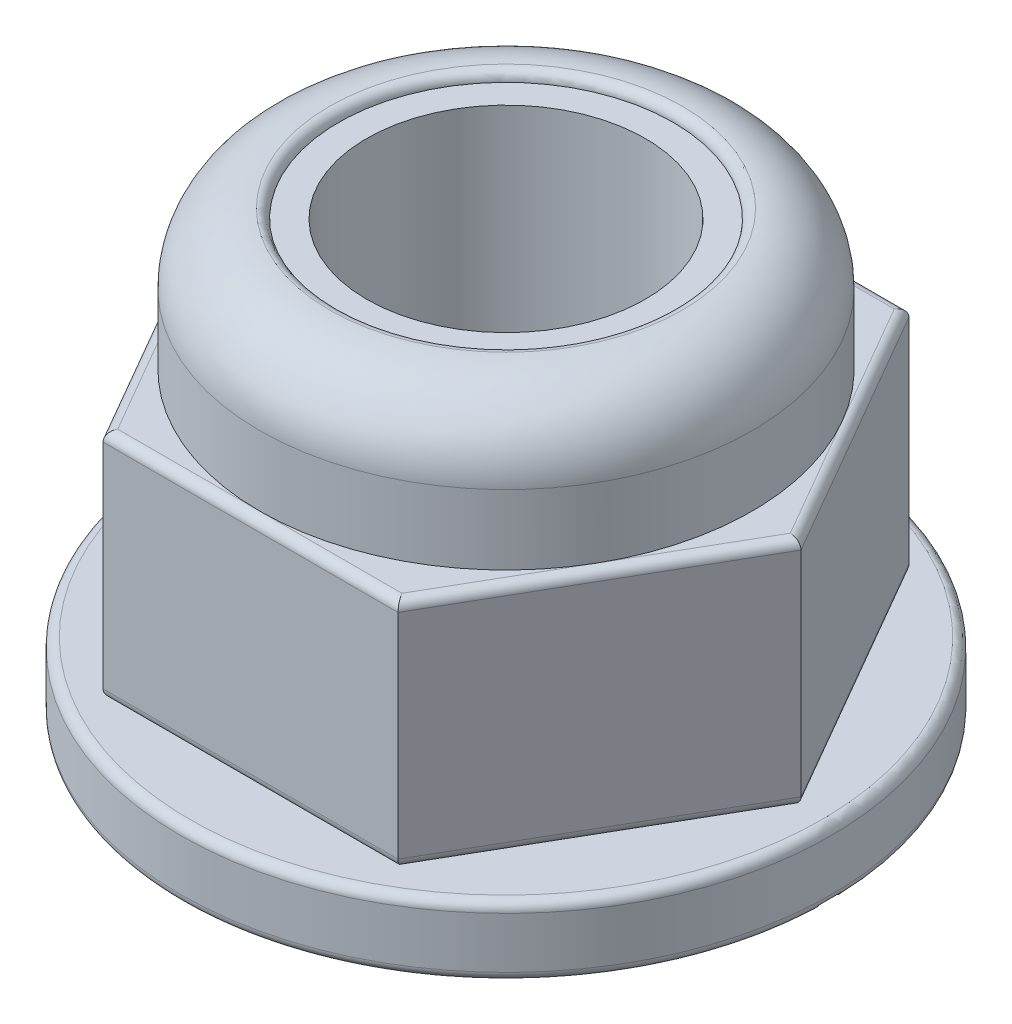
from build123d import *

# Parameters (mm, degrees)
SKETCH1_R           = 1.5
BOSS_EXTRUDE1_DEPTH = 4
FILLET1_R           = 0.1
CUT_EXTRUDE1_START  = -0.1
SKETCH3_R           = 1.8
SKETCH3_R_2         = 1.5
CUT_EXTRUDE1_DEPTH  = 0.1
FILLET2_R           = 0.1
BOSS_EXTRUDE2_START = 0.75
SKETCH4_R           = 3.5
SKETCH4_R_2         = 1.5
BOSS_EXTRUDE2_DEPTH = 0.75
FILLET3_R           = 0.1


# Some blends are built 0.0001 mm under size
with BuildPart() as part:
    # Sketch1 → Boss-Extrude1 (new body)
    with BuildSketch(Plane(origin=(0, 0, 0), x_dir=(1, 0, 0), z_dir=(0, 1, 0))):
        Polygon((1.58771324, -2.75), (3.175426481, 0), (1.58771324, 2.75), (-1.58771324, 2.75), (-3.175426481, 0), (-1.58771324, -2.75), align=None)
        with Locations(Location((0, 0, 0), (0, 0, 270))):
            Circle(SKETCH1_R, mode=Mode.SUBTRACT)
    extrude(amount=BOSS_EXTRUDE1_DEPTH)

    # Sketch2 → Cut-Revolve3 (revolve, cut)
    with BuildSketch(Plane(origin=(0, 0, 0), x_dir=(0, 0, -1), z_dir=(1, 0, 0))):
        with BuildLine():
            Line((-2.65, 3.25), (-2.65, 2.5))
            Line((-2.65, 2.5), (-5.25, 2.5))
            Line((-5.25, 2.5), (-5.25, 4))
            Line((-5.25, 4), (-5.25, 4.1))
            Line((-5.25, 4.1), (-1.9, 4.1))
            Line((-1.9, 4.1), (-1.9, 4))
            ThreePointArc((-1.9, 4), (-2.430330086, 3.780330086), (-2.65, 3.25))
        make_face()
    revolve(axis=Axis((0, 4, 0), (0, -1, 0)), mode=Mode.SUBTRACT)

    # Fillet1
    fillet1_edges = [part.edges().sort_by_distance(p)[0] for p in [
        (0, 0, -1.5),
        (-2.38156986, 2.5, 1.375),
        (2.38156986, 2.5, 1.375),
        (0, 2.5, 2.75),
        (-2.38156986, 2.5, -1.375),
        (0, 2.5, -2.75),
        (2.38156986, 2.5, -1.375),
        (-2.38156986, 0, 1.375),
        (-2.38156986, 0, -1.375),
        (0, 0, -2.75),
        (2.38156986, 0, -1.375),
        (2.38156986, 0, 1.375),
        (0, 0, 2.75),
    ]]
    fillet(fillet1_edges, radius=FILLET1_R - 0.0001)  # a hair under: the kernel refuses the full size

    # Sketch3 → Cut-Extrude1 (cut)
    with BuildSketch(Plane(origin=(0, 4, 0), x_dir=(1, 0, 0), z_dir=(0, 1, 0)).offset(CUT_EXTRUDE1_START)):
        with Locations(Location((0, 0, 0), (0, 0, 270))):
            Circle(SKETCH3_R)
        with Locations(Location((0, 0, 0), (0, 0, 270))):
            Circle(SKETCH3_R_2, mode=Mode.SUBTRACT)
    extrude(amount=CUT_EXTRUDE1_DEPTH, mode=Mode.SUBTRACT)

    # Fillet2
    fillet2_edges = [part.edges().sort_by_distance(p)[0] for p in [
        (0, 4, -1.8),
    ]]
    fillet(fillet2_edges, radius=FILLET2_R - 0.0001)  # a hair under: the kernel refuses the full size

    # Sketch4 → Boss-Extrude2 (add)
    with BuildSketch(Plane.XZ.offset(BOSS_EXTRUDE2_START)):
        with Locations(Location((0, 0, 0), (0, 0, 270))):
            Circle(SKETCH4_R)
        with Locations(Location((0, 0, 0), (0, 0, 90))):
            Circle(SKETCH4_R_2, mode=Mode.SUBTRACT)
    extrude(amount=-BOSS_EXTRUDE2_DEPTH)

    # Fillet3
    # the kernel refuses this fillet: 0.1 mm, written as the material it takes off along each edge
    with BuildSketch(Plane(origin=(0, 0, 0), x_dir=(0, 0, 1), z_dir=(1, 0, 0))) as fillet3_piece_1:
        with BuildLine():
            CenterArc((1.5 + FILLET3_R, FILLET3_R), FILLET3_R, 180, 90)
            Line((1.5 + FILLET3_R, 0), (1.5, 0))
            Line((1.5, 0), (1.5, FILLET3_R))
        make_face()
    revolve(axis=Axis((0, 0, 0), (0, -1, 0)), mode=Mode.SUBTRACT)
    with BuildSketch(Plane(origin=(0, 0, 0), x_dir=(0, 0, -1), z_dir=(-1, 0, 0))) as fillet3_piece_2:
        with BuildLine():
            CenterArc((3.5 - FILLET3_R, FILLET3_R), FILLET3_R, 270, 90)
            Line((3.5 - FILLET3_R, 0), (3.5, 0))
            Line((3.5, 0), (3.5, FILLET3_R))
        make_face()
    revolve(axis=Axis((0, 0, 0), (0, -1, 0)), mode=Mode.SUBTRACT)
    with BuildSketch(Plane(origin=(0, -0.75, 0), x_dir=(0, 0, 1), z_dir=(1, 0, 0))) as fillet3_piece_3:
        with BuildLine():
            CenterArc((1.5 + FILLET3_R, -FILLET3_R), FILLET3_R, 90, 90)
            Line((1.5, -FILLET3_R), (1.5, 0))
            Line((1.5, 0), (1.5 + FILLET3_R, 0))
        make_face()
    revolve(axis=Axis((0, -0.75, 0), (0, -1, 0)), mode=Mode.SUBTRACT)
    with BuildSketch(Plane(origin=(0, -0.75, 0), x_dir=(0, 0, -1), z_dir=(-1, 0, 0))) as fillet3_piece_4:
        with BuildLine():
            CenterArc((3.5 - FILLET3_R, -FILLET3_R), FILLET3_R, 0, 90)
            Line((3.5 - FILLET3_R, 0), (3.5, 0))
            Line((3.5, 0), (3.5, -FILLET3_R))
        make_face()
    revolve(axis=Axis((0, -0.75, 0), (0, -1, 0)), mode=Mode.SUBTRACT)


solid = part.part
